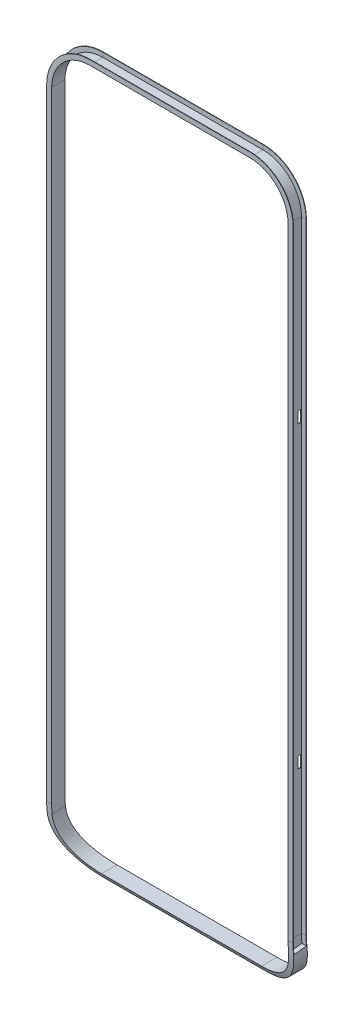
from build123d import *

# Parameters (mm, degrees)
BOSS_EXTRUDE1_DEPTH     = 100
CUT_EXTRUDE1_DEPTH      = 1968.929114577
CUT_EXTRUDE1_DEPTH_BACK = 1968.929114577
SKETCH3_W               = 33
SKETCH3_H               = 12
CAVITY1_START           = 619
CAVITY1_DEPTH           = 1


# Read off the part's stored shape, not the designer's step: Cavity1
with BuildPart() as part:
    # Sketch1 → Boss-Extrude1 (new body)
    with BuildSketch(Plane.XY):
        with BuildLine():
            Line((-13, 100), (-13, 1748))
            ThreePointArc((-13, 1748), (20.096933726, 1827.903066274), (100, 1861))
            Line((100, 1861), (519, 1861))
            ThreePointArc((519, 1861), (598.903066274, 1827.903066274), (632, 1748))
            Line((632, 1748), (632, 100))
            ThreePointArc((632, 100), (598.903066274, 20.096933726), (519, -13))
            Line((519, -13), (100, -13))
            ThreePointArc((100, -13), (20.096933726, 20.096933726), (-13, 100))
        make_face()
        with BuildLine():
            Line((100, 0), (519, 0))
            ThreePointArc((519, 0), (589.710678119, 29.289321881), (619, 100))
            Line((619, 100), (619, 1748))
            ThreePointArc((619, 1748), (589.710678119, 1818.710678119), (519, 1848))
            Line((519, 1848), (100, 1848))
            ThreePointArc((100, 1848), (29.289321881, 1818.710678119), (0, 1748))
            Line((0, 1748), (0, 100))
            ThreePointArc((0, 100), (29.289321881, 29.289321881), (100, 0))
        make_face(mode=Mode.SUBTRACT)
    extrude(amount=-BOSS_EXTRUDE1_DEPTH)

    # Sketch2 → Cut-Extrude1 (cut, two sides: drawn at the far end of the back side and taken through both)
    with BuildSketch(Plane(origin=(0, 0, 0), x_dir=(0, 0, -1), z_dir=(1, 0, 0)).offset(-CUT_EXTRUDE1_DEPTH_BACK)):
        with BuildLine():
            Line((100, 1861), (35, 1861))
            Line((35, 1861), (35, 123.590579564))
            ThreePointArc((35, 123.590579564), (51.869398873, 37.185139921), (100, -36.53))
            Line((100, -36.53), (100, 1861))
        make_face()
        with BuildLine():
            Line((0, -36.53), (53.916588263, -36.53))
            ThreePointArc((53.916588263, -36.53), (13.84098777, 39.113365936), (0, 123.590579564))
            Line((0, 123.590579564), (0, -36.53))
        make_face()
    extrude(amount=CUT_EXTRUDE1_DEPTH + CUT_EXTRUDE1_DEPTH_BACK, mode=Mode.SUBTRACT)

    # Cut-Sweep1: sweep along a curve in space
    with BuildLine() as cut_sweep1_path:
        ThreePointArc((-13, 123.590579564, -35), (-13, 111.779668745, -35.303826234), (-13, 100, -36.214501257))
        Line((-13, 1748, -35), (-13, 123.590579564, -35))
        ThreePointArc((100, 1861, -35), (20.096933726, 1827.903066274, -35), (-13, 1748, -35))
        Line((519, 1861, -35), (100, 1861, -35))
        ThreePointArc((632, 1748, -35), (598.903066274, 1827.903066274, -35), (519, 1861, -35))
        Line((632, 1748, -35), (632, 123.590579564, -35))
        ThreePointArc((632, 123.590579564, -35), (632, 111.779668745, -35.303826234), (632, 100, -36.214501257))
    # Sketch3 → Cut-Sweep1 (sweep, cut)
    with BuildSketch(Plane(origin=(309.5, 0, 0), x_dir=(0, 0, -1), z_dir=(1, 0, 0))):
        with Locations((17.5, 1855)):
            Rectangle(SKETCH3_W, SKETCH3_H)
    sweep(path=cut_sweep1_path.line, mode=Mode.SUBTRACT)

    # Cavity1 outline → Cavity1 (cut)
    with BuildSketch(Plane.YZ.offset(CAVITY1_START)):
        with BuildLine():
            ThreePointArc((1311, -33), (1311.707106781, -32.707106781), (1312, -32))
            Line((1312, -32), (1312, -26))
            ThreePointArc((1312, -26), (1311.707106781, -25.292893219), (1311, -25))
            Line((1311, -25), (1283, -25))
            ThreePointArc((1283, -25), (1282.292893219, -25.292893219), (1282, -26))
            Line((1282, -26), (1282, -32))
            ThreePointArc((1282, -32), (1282.292893219, -32.707106781), (1283, -33))
            Line((1283, -33), (1311, -33))
        make_face()
        with BuildLine():
            Line((501, -33), (529, -33))
            ThreePointArc((529, -33), (529.707106781, -32.707106781), (530, -32))
            Line((530, -32), (530, -26))
            ThreePointArc((530, -26), (529.707106781, -25.292893219), (529, -25))
            Line((529, -25), (501, -25))
            ThreePointArc((501, -25), (500.292893219, -25.292893219), (500, -26))
            Line((500, -26), (500, -32))
            ThreePointArc((500, -32), (500.292893219, -32.707106781), (501, -33))
        make_face()
    extrude(amount=CAVITY1_DEPTH, mode=Mode.SUBTRACT)


solid = part.part
